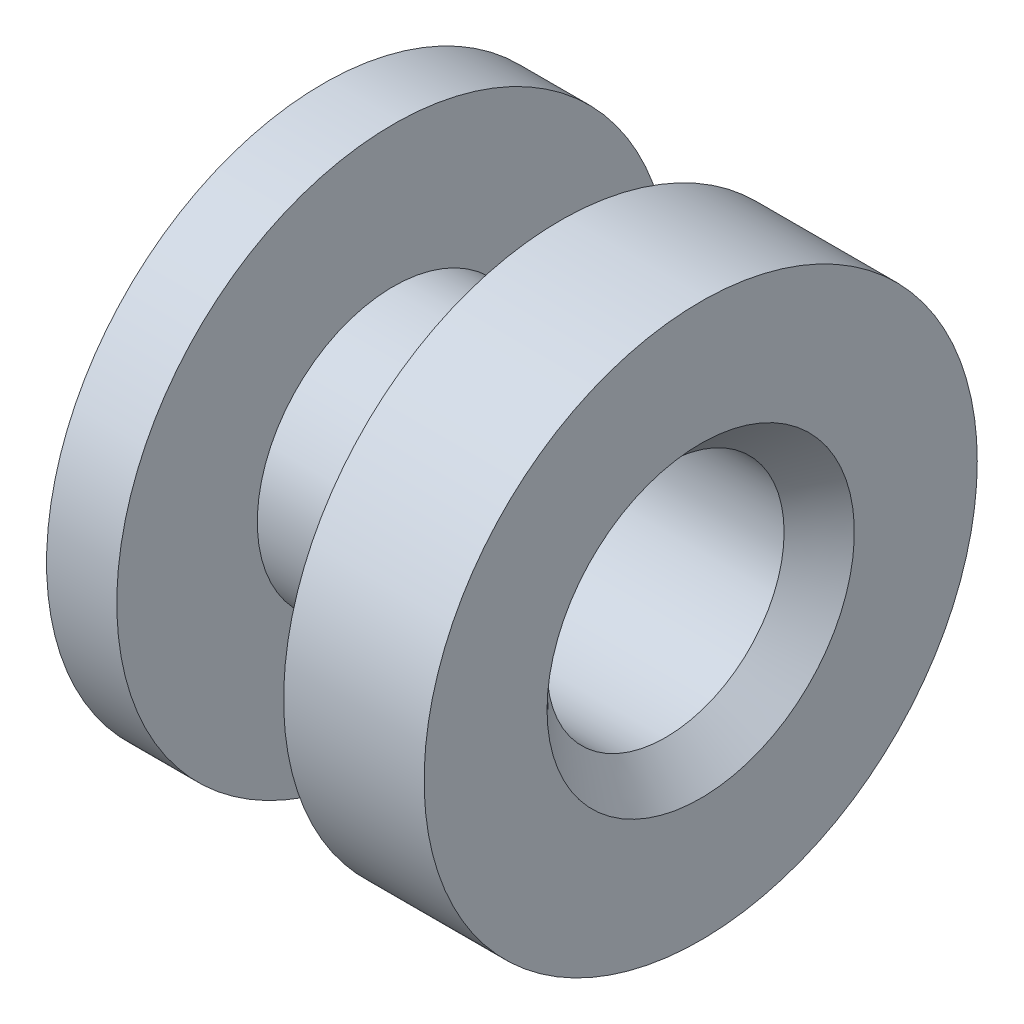
from build123d import *

# Parameters (mm, degrees)
CUT_EXTRUDE1_DEPTH      = 16.726477228
CUT_EXTRUDE1_DEPTH_BACK = 16.726477228
SKETCH3_R               = 3.429
CHAMFER1_SIZE           = 1.016


with BuildPart() as part:
    # Sketch2 → Revolve1 (revolve)
    with BuildSketch(Plane.XY):
        Polygon((0, 7.874), (0, 0), (10.922, 0), (10.922, 8.001), (6.858, 8.001), (6.858, 3.937), (2.032, 3.937), (2.032, 8.001), (0, 8.001), align=None)
    revolve(axis=Axis((10.922, 0, 0), (-1, 0, 0)))

    # Sketch3 → Cut-Extrude1 (cut, two sides: drawn at the far end of the back side and taken through both)
    with BuildSketch(Plane(origin=(10.922, 0, 0), x_dir=(0, 0, -1), z_dir=(1, 0, 0)).offset(-CUT_EXTRUDE1_DEPTH_BACK)):
        Circle(SKETCH3_R)
    extrude(amount=CUT_EXTRUDE1_DEPTH + CUT_EXTRUDE1_DEPTH_BACK, mode=Mode.SUBTRACT)

    # Chamfer1
    chamfer1_edges = [part.edges().sort_by_distance(p)[0] for p in [
        (10.922, 0, 3.429),
    ]]
    chamfer(chamfer1_edges, length=CHAMFER1_SIZE)


solid = part.part
